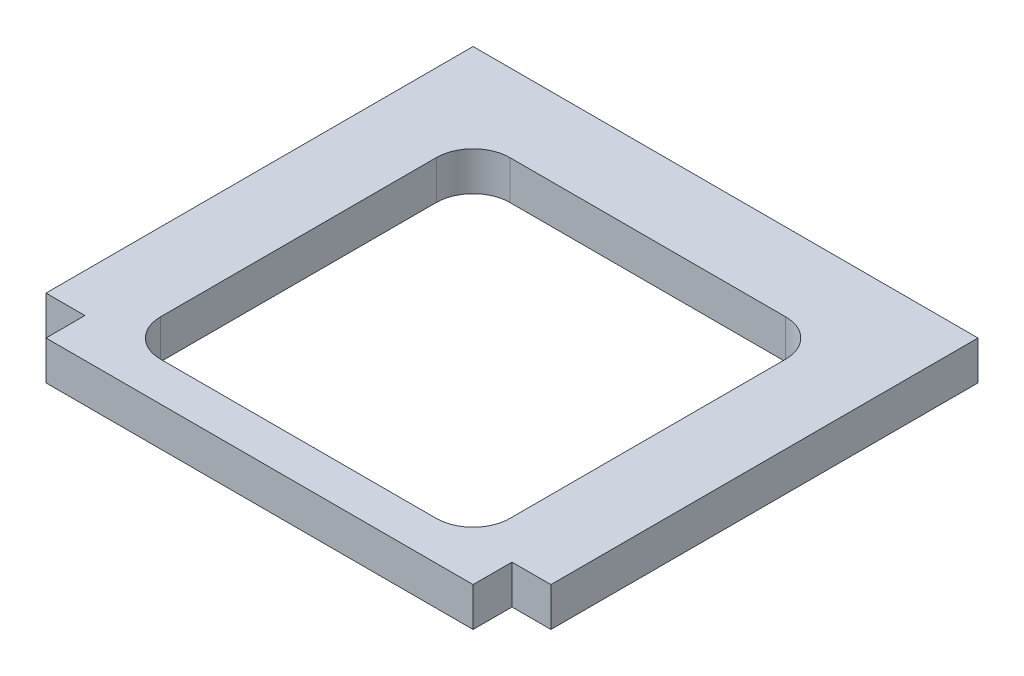
from build123d import *

# Parameters (mm, degrees)
BOSS_EXTRUDE1_DEPTH = 6.35


with BuildPart() as part:
    # Sketch1 → Boss-Extrude1 (new body)
    with BuildSketch(Plane(origin=(0, 0, 0), x_dir=(1, 0, 0), z_dir=(0, 1, 0))):
        Polygon((-41.2, -28.5), (-41.2, 41.2), (41.2, 41.2), (41.2, -28.5), (34.85, -28.5), (34.85, -34.85), (-34.85, -34.85), (-34.85, -28.5), align=None)
        with BuildLine():
            Line((-22.5, -28.5), (22.5, -28.5))
            ThreePointArc((22.5, -28.5), (26.742640687, -26.742640687), (28.5, -22.5))
            Line((28.5, -22.5), (28.5, 22.5))
            ThreePointArc((28.5, 22.5), (26.742640687, 26.742640687), (22.5, 28.5))
            Line((22.5, 28.5), (-22.5, 28.5))
            ThreePointArc((-22.5, 28.5), (-26.742640687, 26.742640687), (-28.5, 22.5))
            Line((-28.5, 22.5), (-28.5, -22.5))
            ThreePointArc((-28.5, -22.5), (-26.742640687, -26.742640687), (-22.5, -28.5))
        make_face(mode=Mode.SUBTRACT)
    extrude(amount=BOSS_EXTRUDE1_DEPTH)


solid = part.part
